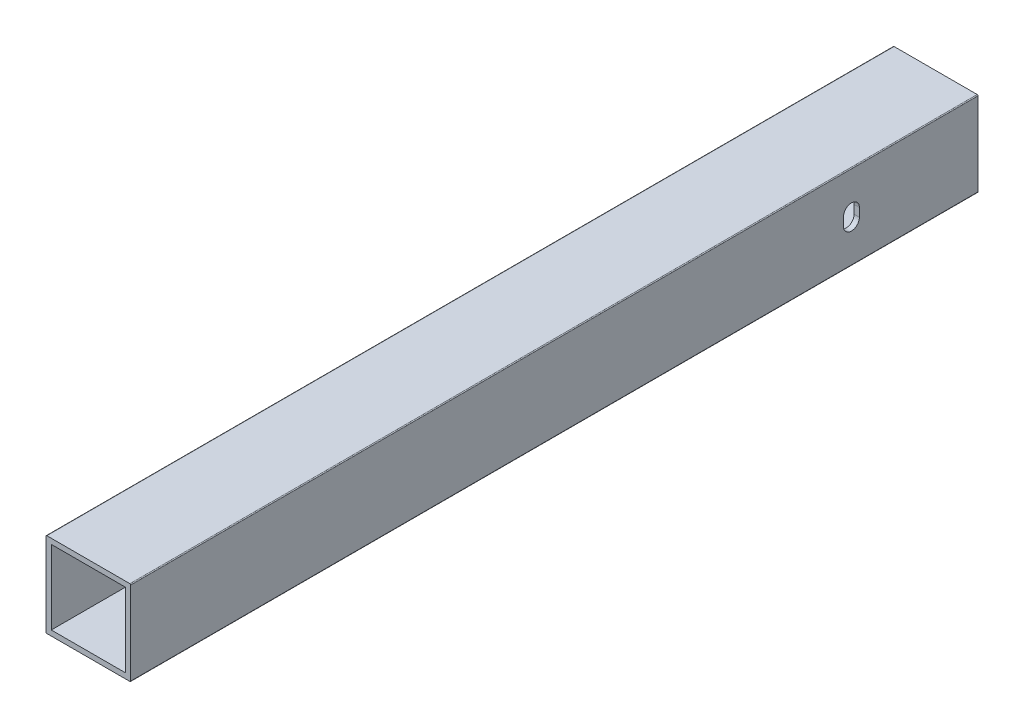
from build123d import *

# Parameters (mm, degrees)
SKETCH1_W           = 22.225
SKETCH1_H           = 22.225
BOSS_EXTRUDE1_DEPTH = 254
CUT_EXTRUDE2_DEPTH  = 257.375106351


with BuildPart() as part:
    # Sketch1 → Boss-Extrude1 (new body)
    with BuildSketch(Plane(origin=(0, 0, 0), x_dir=(-1, 0, 0), z_dir=(0, 0, -1))):
        with BuildLine():
            Line((1.5875, -1.3335), (1.5875, 23.5585))
            ThreePointArc((1.5875, 23.5585), (1.513105122, 23.738105122), (1.3335, 23.8125))
            Line((1.3335, 23.8125), (-23.5585, 23.8125))
            ThreePointArc((-23.5585, 23.8125), (-23.738105122, 23.738105122), (-23.8125, 23.5585))
            Line((-23.8125, 23.5585), (-23.8125, -1.3335))
            ThreePointArc((-23.8125, -1.3335), (-23.738105122, -1.513105122), (-23.5585, -1.5875))
            Line((-23.5585, -1.5875), (1.3335, -1.5875))
            ThreePointArc((1.3335, -1.5875), (1.513105122, -1.513105122), (1.5875, -1.3335))
        make_face()
        with Locations((-11.1125, 11.1125)):
            Rectangle(SKETCH1_W, SKETCH1_H, mode=Mode.SUBTRACT)
    extrude(amount=-BOSS_EXTRUDE1_DEPTH)

    # Sketch4 → Cut-Extrude2 (cut, through all)
    with BuildSketch(Plane(origin=(23.8125, 0, 0), x_dir=(0, 0, -1), z_dir=(1, 0, 0))):
        with BuildLine():
            ThreePointArc((-40.314518304, 9.8425), (-37.933268304, 7.46125), (-35.552018304, 9.8425))
            Line((-35.552018304, 9.8425), (-35.552018304, 12.3825))
            ThreePointArc((-35.552018304, 12.3825), (-37.933268304, 14.76375), (-40.314518304, 12.3825))
            Line((-40.314518304, 12.3825), (-40.314518304, 9.8425))
        make_face()
    extrude(amount=-CUT_EXTRUDE2_DEPTH, mode=Mode.SUBTRACT)


solid = part.part
